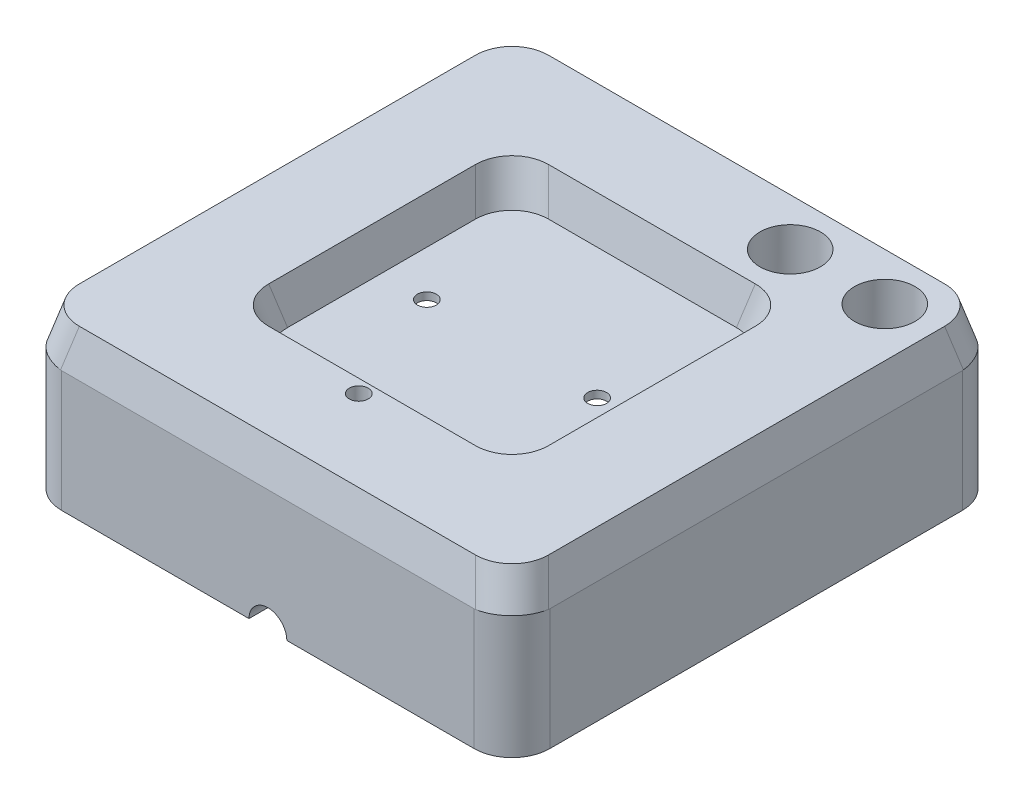
from build123d import *

# Parameters (mm, degrees)
SKETCH1_W           = 129
SKETCH1_H           = 129
SKETCH1_W_2         = 69
SKETCH1_H_2         = 69
EXTRUDE_THIN1_DEPTH = 10
EXTRUDE_THIN1_DRAFT = 14
FILLET1_R           = 10
SKETCH3_W           = 129
SKETCH3_H           = 129
BOSS_EXTRUDE1_DEPTH = 2
SKETCH4_R           = 2.5
CUT_EXTRUDE1_DEPTH  = 2
SKETCH5_W           = 129
SKETCH5_H           = 129
SKETCH5_W_2         = 119
SKETCH5_H_2         = 119
EXTRUDE_THIN2_DEPTH = 30
CUT_EXTRUDE2_DEPTH  = 5
SKETCH7_R           = 2.5
CUT_EXTRUDE3_DEPTH  = 12
FILLET2_R           = 10
SKETCH8_W           = 79
SKETCH8_H           = 5
CUT_EXTRUDE4_DEPTH  = 5
SKETCH9_R           = 8
CUT_EXTRUDE5_DEPTH  = 12
SKETCH9_3_R         = 8
CUT_EXTRUDE6_DEPTH  = 12


with BuildPart() as part:
    # Sketch1 → Extrude-Thin1 (with draft: the straight prism first)
    with BuildSketch(Plane(origin=(0, 0, 0), x_dir=(1, 0, 0), z_dir=(0, 1, 0))):
        Rectangle(SKETCH1_W, SKETCH1_H)
        Rectangle(SKETCH1_W_2, SKETCH1_H_2, mode=Mode.SUBTRACT)
    extrude(amount=EXTRUDE_THIN1_DEPTH)
    # Extrude-Thin1: the draft: its side faces are tilted about the plane it starts from
    extrude_thin1_sides = [part.faces().sort_by_distance(p)[0] for p in [
        (0, 5, -64.5),
        (-64.5, 5, 0),
        (0, 5, 64.5),
        (64.5, 5, 0),
        (34.5, 5, 0),
        (0, 5, 34.5),
        (-34.5, 5, 0),
        (0, 5, -34.5),
    ]]
    draft(extrude_thin1_sides, Plane(origin=(0, 0, 0), x_dir=(1, 0, 0), z_dir=(0, 1, 0)), EXTRUDE_THIN1_DRAFT)

    # Fillet1
    fillet1_edges = [part.edges().sort_by_distance(p)[0] for p in [
        (35.746640014, 5, 35.746640014),
        (35.746640014, 5, -35.746640014),
        (-35.746640014, 5, -35.746640014),
        (-35.746640014, 5, 35.746640014),
    ]]
    fillet(fillet1_edges, radius=FILLET1_R)

    # Sketch3 → Boss-Extrude1 (add)
    with BuildSketch(Plane.XZ):
        Rectangle(SKETCH3_W, SKETCH3_H)
    extrude(amount=BOSS_EXTRUDE1_DEPTH)

    # Sketch4 → Cut-Extrude1 (cut)
    with BuildSketch(Plane(origin=(0, 0, 0), x_dir=(1, 0, 0), z_dir=(0, 1, 0))):
        with Locations(Location((-22.5, 0, 0), (0, 0, 270))):
            Circle(SKETCH4_R)
    cut_extrude1 = extrude(amount=-CUT_EXTRUDE1_DEPTH, mode=Mode.SUBTRACT)

    # Mirror1: Cut-Extrude1 across plane
    add(cut_extrude1.mirror(Plane(origin=(0, 0, 0), x_dir=(0, 0, 1), z_dir=(1, 0, 0))), mode=Mode.SUBTRACT)

    # Sketch5 → Extrude-Thin2 (add)
    with BuildSketch(Plane.XZ.offset(2)):
        Rectangle(SKETCH5_W, SKETCH5_H)
        Rectangle(SKETCH5_W_2, SKETCH5_H_2, mode=Mode.SUBTRACT)
    extrude(amount=EXTRUDE_THIN2_DEPTH)

    # Sketch6 → Cut-Extrude2 (cut)
    with BuildSketch(Plane.XY.offset(64.5)):
        with BuildLine():
            Line((-5, -32), (5, -32))
            ThreePointArc((5, -32), (0, -27), (-5, -32))
        make_face()
    extrude(amount=-CUT_EXTRUDE2_DEPTH, mode=Mode.SUBTRACT)

    # Sketch7 → Cut-Extrude3 (cut)
    with BuildSketch(Plane(origin=(0, 10, 0), x_dir=(1, 0, 0), z_dir=(0, 1, 0))):
        with Locations(Location((0, -40.493280028, 0), (0, 0, 270))):
            Circle(SKETCH7_R)
    extrude(amount=-CUT_EXTRUDE3_DEPTH, mode=Mode.SUBTRACT)

    # Fillet2
    # the kernel refuses this fillet: 10 mm, written as the material it takes off along each edge
    with BuildSketch(Plane(origin=(-64.5, -57, -64.5), x_dir=(1, 0, 0), z_dir=(0, 1, 0)), Plane(origin=(64.5, 25, -64.5), x_dir=(-1, 0, 0), z_dir=(0, -1, 0)), Plane(origin=(-64.5, -57, 64.5), x_dir=(0, 0, -1), z_dir=(0, 1, 0))) as fillet2_piece_1:
        with BuildLine():
            CenterArc((FILLET2_R, -FILLET2_R), FILLET2_R, 90, 90)
            Line((0, -FILLET2_R), (0, 0))
            Line((0, 0), (FILLET2_R, 0))
        make_face()
    extrude(amount=82, mode=Mode.SUBTRACT)
    with BuildSketch(Plane(origin=(64.5, -57, 64.5), x_dir=(0, 0, -1), z_dir=(0, 1, 0))) as fillet2_piece_2:
        with BuildLine():
            CenterArc((FILLET2_R, FILLET2_R), FILLET2_R, 180, 90)
            Line((0, FILLET2_R), (0, 0))
            Line((0, 0), (FILLET2_R, 0))
        make_face()
    extrude(amount=82, mode=Mode.SUBTRACT)
    with BuildSketch(Plane(origin=(70.043929395, -22.235486312, 70.043929395), x_dir=(0.05688523373566075, -0.22815421086671833, -0.9719617925858115), z_dir=(-0.23513883931281052, 0.9430903734495696, -0.23513883931281052)), Plane(origin=(70.043929395, -22.235486312, -70.043929395), x_dir=(-0.9719617925858115, -0.22815421086671833, -0.05688523373566075), z_dir=(-0.23513883931281052, 0.9430903734495696, 0.23513883931281052))) as fillet2_piece_3:
        with BuildLine():
            CenterArc((FILLET2_R * 0.94309037345, FILLET2_R), FILLET2_R, 183.355221767, 86.644778233)
            Line((-FILLET2_R * 0.0551954991819, FILLET2_R * 0.941473796429), (0, 0))
            Line((0, 0), (FILLET2_R * 0.94309037345, 0))
        make_face()
    extrude(amount=57.757956351, mode=Mode.SUBTRACT)
    with BuildSketch(Plane(origin=(-70.043929395, -22.235486312, 70.043929395), x_dir=(-0.05688523373566065, -0.22815421086671833, -0.9719617925858115), z_dir=(0.23513883931281052, 0.9430903734495696, -0.23513883931281052)), Plane(origin=(-70.043929395, -22.235486312, -70.043929395), x_dir=(0.9719617925858115, -0.22815421086671833, -0.05688523373566065), z_dir=(0.23513883931281052, 0.9430903734495696, 0.23513883931281052))) as fillet2_piece_4:
        with BuildLine():
            CenterArc((FILLET2_R * 0.94309037345, -FILLET2_R), FILLET2_R, 90, 86.644778233)
            Line((-FILLET2_R * 0.0551954991819, -FILLET2_R * 0.941473796429), (0, 0))
            Line((0, 0), (FILLET2_R * 0.94309037345, 0))
        make_face()
    extrude(amount=57.757956351, mode=Mode.SUBTRACT)

    # Sketch8 → Cut-Extrude4 (cut)
    with BuildSketch(Plane(origin=(0, 0, -64.5), x_dir=(-1, 0, 0), z_dir=(0, 0, -1))):
        with Locations((0, -19.5)):
            Rectangle(SKETCH8_W, SKETCH8_H)
    extrude(amount=-CUT_EXTRUDE4_DEPTH, mode=Mode.SUBTRACT)

    # Sketch9 → Cut-Extrude5 (cut)
    with BuildSketch(Plane(origin=(0, 10, 0), x_dir=(1, 0, 0), z_dir=(0, 1, 0))):
        with Locations(Location((49.006719972, 49.5, 0), (0, 0, 270))):
            Circle(SKETCH9_R)
    extrude(amount=-CUT_EXTRUDE5_DEPTH, mode=Mode.SUBTRACT)

    # Sketch9<3> → Cut-Extrude6 (cut)
    with BuildSketch(Plane(origin=(0, 10, 0), x_dir=(1, 0, 0), z_dir=(0, 1, 0))):
        with Locations(Location((49.006719972, 49.5, 0), (0, 0, 270))):
            Circle(SKETCH9_3_R)
        with Locations(Location((24.006719972, 49.5, 0), (0, 0, 270))):
            Circle(SKETCH9_3_R)
    extrude(amount=-CUT_EXTRUDE6_DEPTH, mode=Mode.SUBTRACT)


solid = part.part
